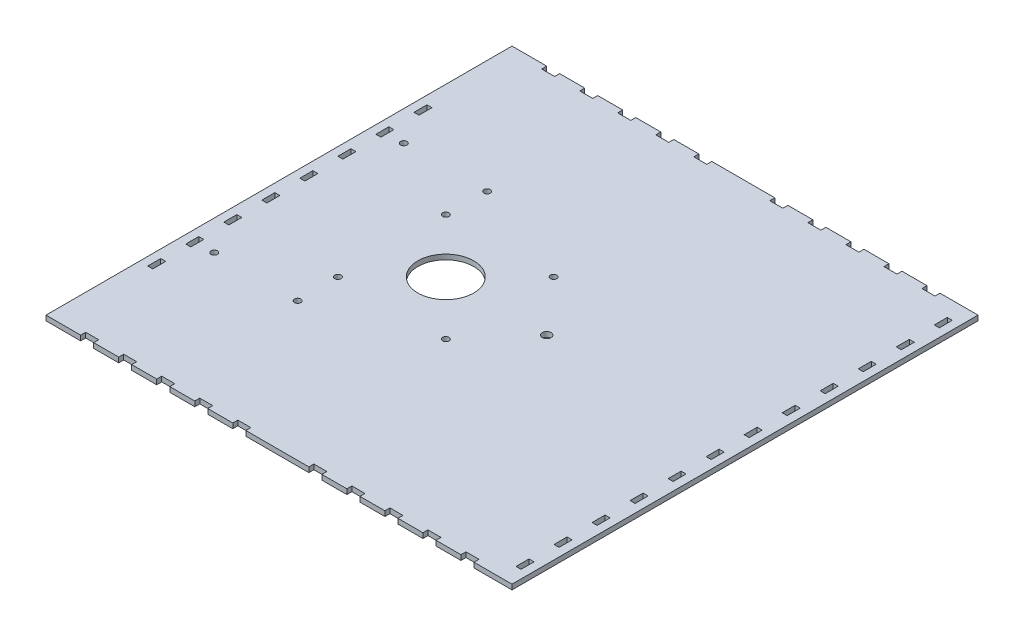
from build123d import *

# Parameters (mm, degrees)
SKETCH1_W                = 279.4
SKETCH1_H                = 279.4
BOSS_EXTRUDE1_DEPTH      = 3
SKETCH3_W                = 3
SKETCH3_H                = 7.8
CUT_EXTRUDE2_DEPTH       = 198.588410591
LPATTERN1_COUNT          = 12
LPATTERN1_PITCH          = 22.8
SKETCH5_W                = 7.8
SKETCH5_H                = 3
CUT_EXTRUDE3_DEPTH       = 198.588410591
LPATTERN2_COUNT          = 11
LPATTERN2_PITCH          = 22.8
MIRROR2_COPY_1_SKETCH_W  = 7.8
MIRROR2_COPY_1_SKETCH_H  = 3
MIRROR2_COPY_1_DEPTH     = 198.588410591
MIRROR2_COPY_2_SKETCH_W  = 7.8
MIRROR2_COPY_2_SKETCH_H  = 3
MIRROR2_COPY_2_DEPTH     = 198.588410591
MIRROR2_COPY_3_SKETCH_W  = 7.8
MIRROR2_COPY_3_SKETCH_H  = 3
MIRROR2_COPY_3_DEPTH     = 198.588410591
MIRROR2_COPY_4_SKETCH_W  = 7.8
MIRROR2_COPY_4_SKETCH_H  = 3
MIRROR2_COPY_4_DEPTH     = 198.588410591
MIRROR2_COPY_5_SKETCH_W  = 7.8
MIRROR2_COPY_5_SKETCH_H  = 3
MIRROR2_COPY_5_DEPTH     = 198.588410591
MIRROR2_COPY_6_SKETCH_W  = 7.8
MIRROR2_COPY_6_SKETCH_H  = 3
MIRROR2_COPY_6_DEPTH     = 198.588410591
MIRROR2_COPY_7_SKETCH_W  = 7.8
MIRROR2_COPY_7_SKETCH_H  = 3
MIRROR2_COPY_7_DEPTH     = 198.588410591
MIRROR2_COPY_8_SKETCH_W  = 7.8
MIRROR2_COPY_8_SKETCH_H  = 3
MIRROR2_COPY_8_DEPTH     = 198.588410591
MIRROR2_COPY_9_SKETCH_W  = 7.8
MIRROR2_COPY_9_SKETCH_H  = 3
MIRROR2_COPY_9_DEPTH     = 198.588410591
MIRROR2_COPY_10_SKETCH_W = 7.8
MIRROR2_COPY_10_SKETCH_H = 3
MIRROR2_COPY_10_DEPTH    = 198.588410591
SKETCH6_W                = 3
SKETCH6_H                = 7.8
CUT_EXTRUDE4_DEPTH       = 198.588410591
LPATTERN3_COUNT          = 8
LPATTERN3_PITCH          = 22.8
SKETCH7_R                = 16.75
CUT_EXTRUDE5_DEPTH       = 198.588410591
F_6_CLEARANCE_HOLE1_D    = 3.7973
F_6_CLEARANCE_HOLE2_D    = 3.7973
SKETCH14_R               = 2.65
CUT_EXTRUDE6_DEPTH       = 198.588410591


with BuildPart() as part:
    # Sketch1 → Boss-Extrude1 (new body)
    with BuildSketch(Plane(origin=(0, 0, 0), x_dir=(1, 0, 0), z_dir=(0, 1, 0))):
        Rectangle(SKETCH1_W, SKETCH1_H)
    extrude(amount=BOSS_EXTRUDE1_DEPTH)

    # Sketch3 → Cut-Extrude2 (cut, through all)
    with BuildSketch(Plane(origin=(0, 0, 0), x_dir=(-1, 0, 0), z_dir=(0, -1, 0))):
        with Locations((-133.2, 125.4)):
            Rectangle(SKETCH3_W, SKETCH3_H)
    cut_extrude2 = extrude(amount=-CUT_EXTRUDE2_DEPTH, mode=Mode.SUBTRACT)

    # LPattern1: Cut-Extrude2 ×12
    with Locations(*[(0, 0, i * LPATTERN1_PITCH) for i in range(1, LPATTERN1_COUNT)]):
        add(cut_extrude2, mode=Mode.SUBTRACT)

    # Sketch5 → Cut-Extrude3 (cut, through all)
    with BuildSketch(Plane.XZ):
        with Locations((113, -138.2)):
            Rectangle(SKETCH5_W, SKETCH5_H)
    cut_extrude3 = extrude(amount=-CUT_EXTRUDE3_DEPTH, mode=Mode.SUBTRACT)

    # LPattern2: Cut-Extrude3 ×11, 1 skipped
    with Locations(*[(-i * LPATTERN2_PITCH, 0, 0) for i in range(1, LPATTERN2_COUNT) if i not in (5,)]):
        add(cut_extrude3, mode=Mode.SUBTRACT)

    # Mirror2 copy 1 sketch → Mirror2 copy 1 (cut, through all)
    with BuildSketch(Plane(origin=(-22.8, 0, 0), x_dir=(1, 0, 0), z_dir=(0, -1, 0))):
        with Locations((113, 138.2)):
            Rectangle(MIRROR2_COPY_1_SKETCH_W, MIRROR2_COPY_1_SKETCH_H)
    extrude(amount=-MIRROR2_COPY_1_DEPTH, mode=Mode.SUBTRACT)

    # Mirror2 copy 2 sketch → Mirror2 copy 2 (cut, through all)
    with BuildSketch(Plane(origin=(-45.6, 0, 0), x_dir=(1, 0, 0), z_dir=(0, -1, 0))):
        with Locations((113, 138.2)):
            Rectangle(MIRROR2_COPY_2_SKETCH_W, MIRROR2_COPY_2_SKETCH_H)
    extrude(amount=-MIRROR2_COPY_2_DEPTH, mode=Mode.SUBTRACT)

    # Mirror2 copy 3 sketch → Mirror2 copy 3 (cut, through all)
    with BuildSketch(Plane(origin=(-68.4, 0, 0), x_dir=(1, 0, 0), z_dir=(0, -1, 0))):
        with Locations((113, 138.2)):
            Rectangle(MIRROR2_COPY_3_SKETCH_W, MIRROR2_COPY_3_SKETCH_H)
    extrude(amount=-MIRROR2_COPY_3_DEPTH, mode=Mode.SUBTRACT)

    # Mirror2 copy 4 sketch → Mirror2 copy 4 (cut, through all)
    with BuildSketch(Plane(origin=(-91.2, 0, 0), x_dir=(1, 0, 0), z_dir=(0, -1, 0))):
        with Locations((113, 138.2)):
            Rectangle(MIRROR2_COPY_4_SKETCH_W, MIRROR2_COPY_4_SKETCH_H)
    extrude(amount=-MIRROR2_COPY_4_DEPTH, mode=Mode.SUBTRACT)

    # Mirror2 copy 5 sketch → Mirror2 copy 5 (cut, through all)
    with BuildSketch(Plane(origin=(-136.8, 0, 0), x_dir=(1, 0, 0), z_dir=(0, -1, 0))):
        with Locations((113, 138.2)):
            Rectangle(MIRROR2_COPY_5_SKETCH_W, MIRROR2_COPY_5_SKETCH_H)
    extrude(amount=-MIRROR2_COPY_5_DEPTH, mode=Mode.SUBTRACT)

    # Mirror2 copy 6 sketch → Mirror2 copy 6 (cut, through all)
    with BuildSketch(Plane(origin=(-159.6, 0, 0), x_dir=(1, 0, 0), z_dir=(0, -1, 0))):
        with Locations((113, 138.2)):
            Rectangle(MIRROR2_COPY_6_SKETCH_W, MIRROR2_COPY_6_SKETCH_H)
    extrude(amount=-MIRROR2_COPY_6_DEPTH, mode=Mode.SUBTRACT)

    # Mirror2 copy 7 sketch → Mirror2 copy 7 (cut, through all)
    with BuildSketch(Plane(origin=(-182.4, 0, 0), x_dir=(1, 0, 0), z_dir=(0, -1, 0))):
        with Locations((113, 138.2)):
            Rectangle(MIRROR2_COPY_7_SKETCH_W, MIRROR2_COPY_7_SKETCH_H)
    extrude(amount=-MIRROR2_COPY_7_DEPTH, mode=Mode.SUBTRACT)

    # Mirror2 copy 8 sketch → Mirror2 copy 8 (cut, through all)
    with BuildSketch(Plane(origin=(-205.2, 0, 0), x_dir=(1, 0, 0), z_dir=(0, -1, 0))):
        with Locations((113, 138.2)):
            Rectangle(MIRROR2_COPY_8_SKETCH_W, MIRROR2_COPY_8_SKETCH_H)
    extrude(amount=-MIRROR2_COPY_8_DEPTH, mode=Mode.SUBTRACT)

    # Mirror2 copy 9 sketch → Mirror2 copy 9 (cut, through all)
    with BuildSketch(Plane(origin=(-228, 0, 0), x_dir=(1, 0, 0), z_dir=(0, -1, 0))):
        with Locations((113, 138.2)):
            Rectangle(MIRROR2_COPY_9_SKETCH_W, MIRROR2_COPY_9_SKETCH_H)
    extrude(amount=-MIRROR2_COPY_9_DEPTH, mode=Mode.SUBTRACT)

    # Mirror2 copy 10 sketch → Mirror2 copy 10 (cut, through all)
    with BuildSketch(Plane.XZ):
        with Locations((113, 138.2)):
            Rectangle(MIRROR2_COPY_10_SKETCH_W, MIRROR2_COPY_10_SKETCH_H)
    extrude(amount=-MIRROR2_COPY_10_DEPTH, mode=Mode.SUBTRACT)

    # Sketch6 → Cut-Extrude4 (cut, through all)
    with BuildSketch(Plane.XZ):
        with Locations((-133.2, -79.8)):
            Rectangle(SKETCH6_W, SKETCH6_H)
    cut_extrude4 = extrude(amount=-CUT_EXTRUDE4_DEPTH, mode=Mode.SUBTRACT)

    # LPattern3: Cut-Extrude4 ×8
    with Locations(*[(0, 0, i * LPATTERN3_PITCH) for i in range(1, LPATTERN3_COUNT)]):
        add(cut_extrude4, mode=Mode.SUBTRACT)

    # Sketch7 → Cut-Extrude5 (cut, through all)
    with BuildSketch(Plane(origin=(0, 0, 0), x_dir=(-1, 0, 0), z_dir=(0, -1, 0))):
        with Locations((39.7, 0)):
            Circle(SKETCH7_R)
    extrude(amount=-CUT_EXTRUDE5_DEPTH, mode=Mode.SUBTRACT)

    # #6 Clearance Hole1 (through all)
    with Locations(Plane(origin=(0, 3, 0), x_dir=(1, 0, 0), z_dir=(0, 1, 0))):
        with Locations((-72.025, -32.325), (-72.025, 32.325), (-7.375, 32.325), (-7.375, -32.325)):
            Hole(F_6_CLEARANCE_HOLE1_D / 2)

    # #6 Clearance Hole2 (through all)
    with Locations(Plane(origin=(0, 3, 0), x_dir=(1, 0, 0), z_dir=(0, 1, 0))):
        with Locations((-121.7, 56.83), (-71.7, 56.83), (-121.7, -56.83), (-71.7, -56.83)):
            Hole(F_6_CLEARANCE_HOLE2_D / 2)

    # Sketch14 → Cut-Extrude6 (cut, through all)
    with BuildSketch(Plane(origin=(0, 0, 0), x_dir=(-1, 0, 0), z_dir=(0, -1, 0))):
        with Locations((-20.8, 0)):
            Circle(SKETCH14_R)
    extrude(amount=-CUT_EXTRUDE6_DEPTH, mode=Mode.SUBTRACT)


solid = part.part
